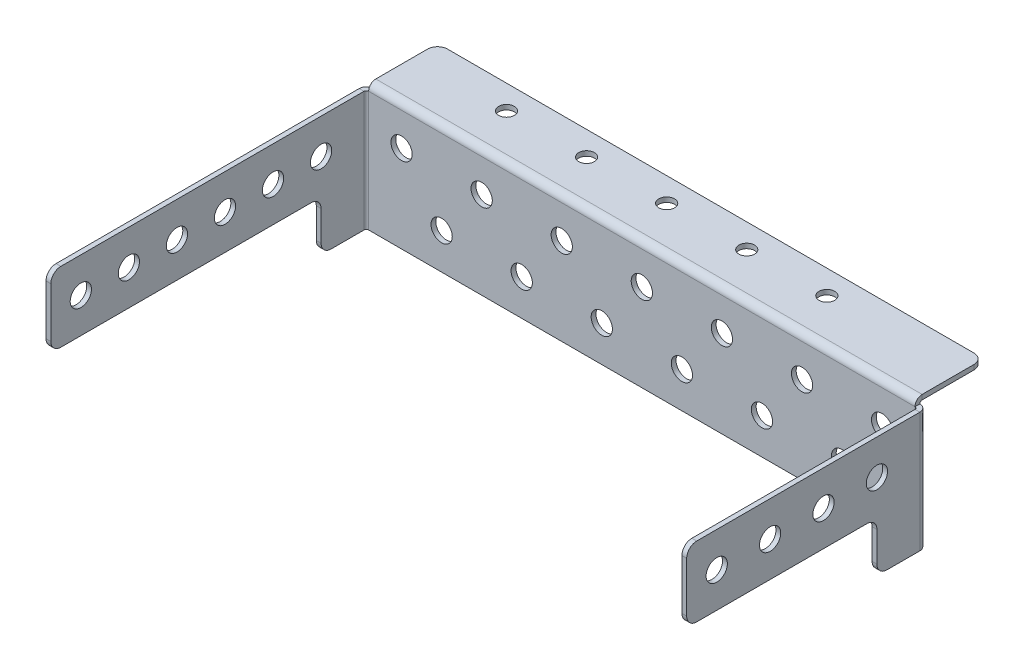
from build123d import *

# Parameters (mm, degrees)
BASE_FLANGE1_DEPTH      = 19.05
EDGE_FLANGE1_DEPTH      = 173.2788
EDGE_FLANGE1_START      = 1.524
EDGE_FLANGE1_PROFILE_W  = 173.2788
EDGE_FLANGE1_PROFILE_H  = 19.5834
EDGE_FLANGE1_PROFILE_R  = 2.4892
EDGE_FLANGE1_FLAT_DEPTH = 1.524
SKETCH9_W               = 85.725
SKETCH9_H               = 15.875
CUT_EXTRUDE1_DEPTH      = 206.887206189
SKETCH10_R              = 3.3734375
CUT_EXTRUDE2_DEPTH      = 1.524
CRVPATTERN1_START       = -82.55
CRVPATTERN1_OUTLINE_R   = 3.3734375
CRVPATTERN1_DEPTH       = 1.524
CUT_EXTRUDE3_START      = -1.524
SKETCH11_R              = 3.3734375
CUT_EXTRUDE3_DEPTH      = 1.524
CRVPATTERN2_START       = 93.726
CRVPATTERN2_OUTLINE_R   = 3.3734375
CRVPATTERN2_DEPTH       = 1.524
SKETCH12_R              = 3.3734375
CUT_EXTRUDE4_DEPTH      = 1.524
LPATTERN1_COUNT         = 6
LPATTERN1_PITCH         = 25.4
SKETCH13_R              = 3.3734375
CUT_EXTRUDE5_DEPTH      = 1.524
FILLET1_R               = 3.175


# Read off the part's stored shape, not the designer's step: CrvPattern1, CrvPattern2
# Sheet-metal steps are written as plain solids
with BuildPart() as part:
    # Sketch1 → Base-Flange1 (new, symmetric)
    with BuildSketch(Plane(origin=(0, 0, 0), x_dir=(1, 0, 0), z_dir=(0, 1, 0))):
        with BuildLine():
            Line((-82.55, -101.6), (-82.55, -2.2606))
            ThreePointArc((-82.55, -2.2606), (-81.88788559, -0.66211441), (-80.2894, 0))
            Line((-80.2894, 0), (92.9894, 0))
            ThreePointArc((92.9894, 0), (94.58788559, -0.66211441), (95.25, -2.2606))
            Line((95.25, -2.2606), (95.25, -76.2))
            Line((95.25, -76.2), (93.726, -76.2))
            Line((93.726, -76.2), (93.726, -2.2606))
            ThreePointArc((93.726, -2.2606), (93.510254855, -1.739745145), (92.9894, -1.524))
            Line((92.9894, -1.524), (-80.2894, -1.524))
            ThreePointArc((-80.2894, -1.524), (-80.810254855, -1.739745145), (-81.026, -2.2606))
            Line((-81.026, -2.2606), (-81.026, -101.6))
            Line((-81.026, -101.6), (-82.55, -101.6))
        make_face()
    extrude(amount=BASE_FLANGE1_DEPTH, both=True)

    # Edge-Flange1 bend section (across the edge) → Edge-Flange1 (add)
    with BuildSketch(Plane(origin=(-80.2894, 19.7866, 0), x_dir=(0, -1, 0), z_dir=(1, 0, 0))):
        with BuildLine():
            Line((-1.524, 0.7366), (0, 0.7366))
            ThreePointArc((0, 0.7366), (0.215745145, 0.215745145), (0.7366, 0))
            Line((0.7366, 0), (0.7366, -1.524))
            ThreePointArc((0.7366, -1.524), (-0.86188559, -0.86188559), (-1.524, 0.7366))
        make_face()
    extrude(amount=EDGE_FLANGE1_DEPTH)

    # Edge-Flange1 profile (on flange) → Edge-Flange1 flat (add)
    with BuildSketch(Plane(origin=(0, 19.7866, 0), x_dir=(1, 0, 0), z_dir=(0, 1, 0)).offset(EDGE_FLANGE1_START)):
        with Locations((6.35, 10.5283)):
            Rectangle(EDGE_FLANGE1_PROFILE_W, EDGE_FLANGE1_PROFILE_H)
        with Locations((0, 12.7)):
            Circle(EDGE_FLANGE1_PROFILE_R, mode=Mode.SUBTRACT)
        with Locations((25.4, 12.7)):
            Circle(EDGE_FLANGE1_PROFILE_R, mode=Mode.SUBTRACT)
        with Locations((50.8, 12.7)):
            Circle(EDGE_FLANGE1_PROFILE_R, mode=Mode.SUBTRACT)
        with Locations((-50.8, 12.7)):
            Circle(EDGE_FLANGE1_PROFILE_R, mode=Mode.SUBTRACT)
        with Locations((-25.4, 12.7)):
            Circle(EDGE_FLANGE1_PROFILE_R, mode=Mode.SUBTRACT)
    extrude(amount=-EDGE_FLANGE1_FLAT_DEPTH)

    # Sketch9 → Cut-Extrude1 (cut, through all)
    with BuildSketch(Plane(origin=(95.25, 0, 0), x_dir=(0, 0, -1), z_dir=(1, 0, 0))):
        with Locations((-58.7375, -11.1125)):
            Rectangle(SKETCH9_W, SKETCH9_H)
    extrude(amount=-CUT_EXTRUDE1_DEPTH, mode=Mode.SUBTRACT)

    # Sketch10 → Cut-Extrude2 (cut)
    with BuildSketch(Plane.ZY.offset(82.55)):
        with Locations((15.875, 7.9375)):
            Circle(SKETCH10_R)
    extrude(amount=-CUT_EXTRUDE2_DEPTH, mode=Mode.SUBTRACT)

    # CrvPattern1 outline → CrvPattern1 (cut)
    with BuildSketch(Plane.YZ.offset(CRVPATTERN1_START)):
        with Locations((7.9375, 92.075)):
            Circle(CRVPATTERN1_OUTLINE_R)
        with Locations((7.9375, 76.835)):
            Circle(CRVPATTERN1_OUTLINE_R)
        with Locations((7.9375, 61.595)):
            Circle(CRVPATTERN1_OUTLINE_R)
        with Locations((7.9375, 46.355)):
            Circle(CRVPATTERN1_OUTLINE_R)
        with Locations((7.9375, 31.115)):
            Circle(CRVPATTERN1_OUTLINE_R)
    extrude(amount=CRVPATTERN1_DEPTH, mode=Mode.SUBTRACT)

    # Sketch11 → Cut-Extrude3 (cut)
    with BuildSketch(Plane(origin=(95.25, 0, 0), x_dir=(0, 0, -1), z_dir=(1, 0, 0)).offset(CUT_EXTRUDE3_START)):
        with Locations(Location((-15.875, 7.9375, 0), (0, 0, 180))):
            Circle(SKETCH11_R)
    extrude(amount=CUT_EXTRUDE3_DEPTH, mode=Mode.SUBTRACT)

    # CrvPattern2 outline → CrvPattern2 (cut)
    with BuildSketch(Plane.YZ.offset(CRVPATTERN2_START)):
        with Locations((7.9375, 66.675)):
            Circle(CRVPATTERN2_OUTLINE_R)
        with Locations((7.9375, 49.741666667)):
            Circle(CRVPATTERN2_OUTLINE_R)
        with Locations((7.9375, 32.808333333)):
            Circle(CRVPATTERN2_OUTLINE_R)
    extrude(amount=CRVPATTERN2_DEPTH, mode=Mode.SUBTRACT)

    # Sketch12 → Cut-Extrude4 (cut)
    with BuildSketch(Plane.XY.offset(1.524)):
        with Locations((-69.85, 8.6106)):
            Circle(SKETCH12_R)
        with Locations((-57.15, -7.62)):
            Circle(SKETCH12_R)
    cut_extrude4 = extrude(amount=-CUT_EXTRUDE4_DEPTH, mode=Mode.SUBTRACT)

    # LPattern1: Cut-Extrude4 ×6
    with Locations(*[(i * LPATTERN1_PITCH, 0, 0) for i in range(1, LPATTERN1_COUNT)]):
        add(cut_extrude4, mode=Mode.SUBTRACT)

    # Sketch13 → Cut-Extrude5 (cut)
    with BuildSketch(Plane.XY.offset(1.524)):
        with Locations((82.55, 8.6106)):
            Circle(SKETCH13_R)
    extrude(amount=-CUT_EXTRUDE5_DEPTH, mode=Mode.SUBTRACT)

    # Fillet1
    fillet1_edges = [part.edges().sort_by_distance(p)[0] for p in [
        (-81.788, 19.05, 101.6),
        (-80.2894, 20.5486, -20.32),
        (92.9894, 20.5486, -20.32),
        (94.488, 19.05, 76.2),
        (94.488, -19.05, 15.875),
        (-81.788, -19.05, 15.875),
        (-81.788, -3.175, 101.6),
        (94.488, -3.175, 15.875),
        (-81.788, -3.175, 15.875),
        (94.488, -3.175, 76.2),
    ]]
    fillet(fillet1_edges, radius=FILLET1_R)


solid = part.part
